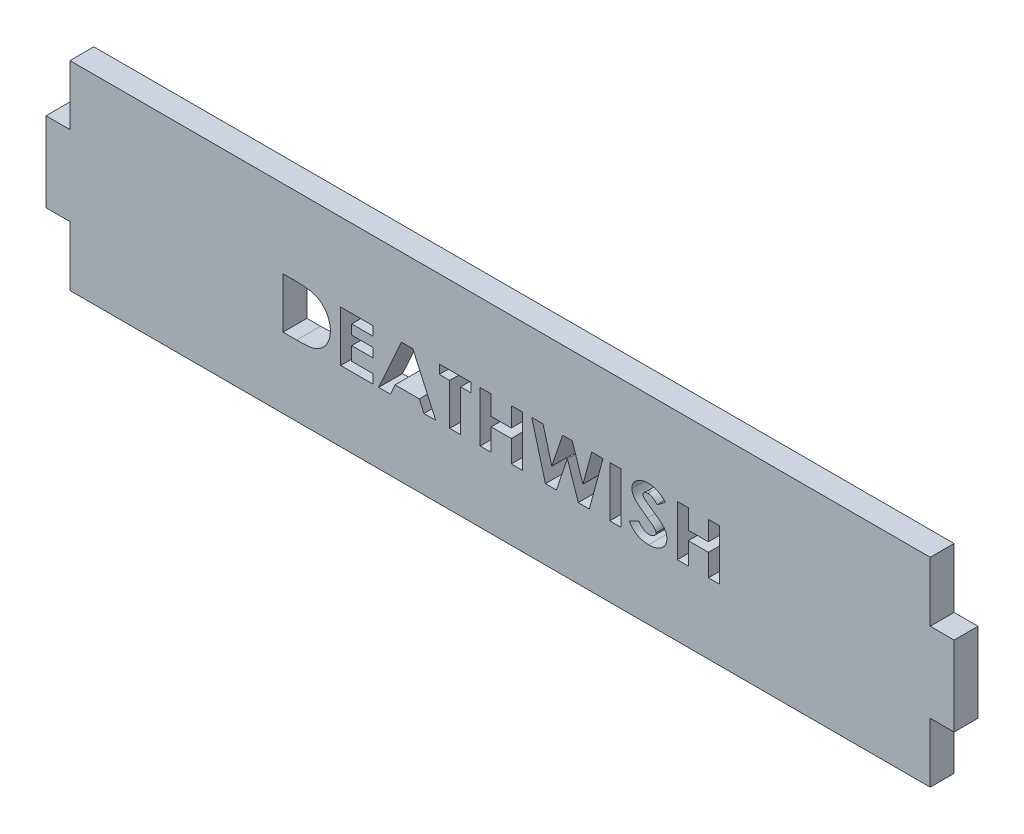
from build123d import *

# Parameters (mm, degrees)
BOSS_EXTRUDE1_DEPTH = 3
WRAP1_START         = -3
WRAP1_OUTLINE_W     = 1.383974359
WRAP1_OUTLINE_H     = 6.35
WRAP1_DEPTH         = 3


# Read off the part's stored shape, not the designer's step: Wrap1
with BuildPart() as part:
    # Sketch1 → Boss-Extrude1 (new body)
    with BuildSketch(Plane.XY):
        Polygon((54, -5), (54, -12.5), (-54, -12.5), (-54, -5), (-57, -5), (-57, 5), (-54, 5), (-54, 12.5), (54, 12.5), (54, 5), (57, 5), (57, -5), align=None)
    extrude(amount=BOSS_EXTRUDE1_DEPTH)

    # Wrap1 outline → Wrap1 (cut)
    with BuildSketch(Plane.XY.offset(3).offset(WRAP1_START)):
        with BuildLine():
            add(Edge.make_bspline(
                [(19.719246452, 1.072586443), (19.673401835, 1.124225586), (19.584720231, 1.224116093), (19.442937176, 1.356836127), (19.300478912, 1.469406847), (19.157579951, 1.561886065), (19.014110041, 1.634456814), (18.869277928, 1.685740762), (18.723379294, 1.717847792), (18.625451821, 1.721874497), (18.576958791, 1.723868494)],
                knots=[0, 0, 0, 0, 0.152659398, 0.295303603, 0.428877079, 0.553739135, 0.671167669, 0.783579981, 0.892830255, 1, 1, 1, 1], degree=3))
            Line((19.719246452, 1.072586443), (20.783939961, 1.852344055))
            add(Edge.make_bspline(
                [(18.613847814, 2.863612084), (18.70643363, 2.860873856), (18.890380695, 2.855433617), (19.16228875, 2.81326962), (19.427575195, 2.745992557), (19.642797731, 2.665774715), (19.813752234, 2.586623289), (19.944941907, 2.515071376), (20.07825411, 2.43143095), (20.216252432, 2.33952036), (20.354153761, 2.232877684), (20.495878314, 2.116718826), (20.640899351, 1.990251419), (20.735567321, 1.898980764), (20.783939961, 1.852344055)],
                knots=[0, 0, 0, 0, 0.112750237, 0.224009204, 0.33438332, 0.445685447, 0.503228736, 0.563788081, 0.627576777, 0.694912236, 0.765680889, 0.839822751, 0.918153981, 1, 1, 1, 1], degree=3))
            add(Edge.make_bspline(
                [(16.550606628, 1.25321545), (16.552167553, 1.307613976), (16.555249959, 1.41503643), (16.584415688, 1.573159065), (16.631608342, 1.725098667), (16.697108485, 1.871051885), (16.780618975, 2.011493206), (16.884491355, 2.144676521), (17.006080325, 2.272300549), (17.14416979, 2.39222325), (17.295915834, 2.502386826), (17.458624243, 2.598965288), (17.630359097, 2.680681123), (17.810182703, 2.748535855), (17.998874304, 2.80042905), (18.196262366, 2.83745452), (18.402207702, 2.859016452), (18.542563622, 2.862064193), (18.613847814, 2.863612084)],
                knots=[0, 0, 0, 0, 0.056170461, 0.110921546, 0.165526908, 0.220249932, 0.275858717, 0.333966338, 0.394404589, 0.457760192, 0.522706535, 0.587934591, 0.653003504, 0.719006979, 0.786299609, 0.854964891, 0.926339335, 1, 1, 1, 1], degree=3))
            add(Edge.make_bspline(
                [(18.523533311, -0.97539032), (18.424075574, -0.907042495), (18.233457958, -0.776049173), (17.963244973, -0.582337552), (17.720104258, -0.401105641), (17.505097159, -0.230916602), (17.317716127, -0.072977709), (17.156492133, 0.071260309), (17.023759429, 0.204442524), (16.91596119, 0.32801057), (16.829642335, 0.446549171), (16.754552473, 0.561418865), (16.692554997, 0.676993622), (16.64111885, 0.792622531), (16.599757539, 0.9075868), (16.572438211, 1.023321193), (16.552878188, 1.138066694), (16.551361041, 1.214973115), (16.550606628, 1.25321545)],
                knots=[0, 0, 0, 0, 0.11724404, 0.224706294, 0.32299845, 0.411847771, 0.491072557, 0.561070729, 0.621952114, 0.673650235, 0.720202811, 0.764310708, 0.806887658, 0.847460379, 0.88719842, 0.925365868, 0.962887579, 1, 1, 1, 1], degree=3))
            add(Edge.make_bspline(
                [(19.562786115, -2.070612675), (19.560703997, -2.034249343), (19.556434143, -1.95967813), (19.515799337, -1.850105941), (19.455190375, -1.74062135), (19.384696712, -1.651377285), (19.312833797, -1.576388272), (19.242436675, -1.512273418), (19.158696848, -1.439340768), (19.058882889, -1.361211416), (18.94566796, -1.2747121), (18.818581091, -1.180208885), (18.675771695, -1.080329999), (18.575728703, -1.011369208), (18.523533311, -0.97539032)],
                knots=[0, 0, 0, 0, 0.069656103, 0.142845548, 0.221998529, 0.309697071, 0.360419396, 0.421544443, 0.492611602, 0.573810517, 0.665086112, 0.766465276, 0.878158015, 1, 1, 1, 1], degree=3))
            add(Edge.make_bspline(
                [(18.688897894, -2.672285352), (18.748456429, -2.670303674), (18.863552102, -2.666474122), (19.028103054, -2.630935131), (19.17898, -2.575443349), (19.310126356, -2.495335577), (19.421246783, -2.403650429), (19.502572821, -2.300351922), (19.554387547, -2.188300791), (19.559995875, -2.109711979), (19.562786115, -2.070612675)],
                knots=[0, 0, 0, 0, 0.152897008, 0.2954704, 0.430684796, 0.564139584, 0.688618973, 0.798927781, 0.899963069, 1, 1, 1, 1], degree=3))
            add(Edge.make_bspline(
                [(17.433399096, -1.858182788), (17.47838077, -1.922733208), (17.565307704, -2.047476682), (17.711239748, -2.212734273), (17.860184903, -2.354521837), (18.015110736, -2.470775904), (18.176132952, -2.560469536), (18.342418332, -2.625307473), (18.514041923, -2.664929211), (18.630605876, -2.669833023), (18.688897894, -2.672285352)],
                knots=[0, 0, 0, 0, 0.151131279, 0.292060695, 0.42295247, 0.545866055, 0.663349338, 0.776115142, 0.888038283, 1, 1, 1, 1], degree=3))
            Line((17.433399096, -1.858182788), (16.224965602, -2.459855464))
            add(Edge.make_bspline(
                [(18.641832589, -3.812028941), (18.576080432, -3.811082137), (18.446515105, -3.80921645), (18.255400672, -3.793547964), (18.070619205, -3.768339328), (17.89215972, -3.732767085), (17.720077491, -3.686929042), (17.554575131, -3.631295848), (17.39591194, -3.564331197), (17.242748975, -3.488476763), (17.095971952, -3.399879146), (16.954497682, -3.300851248), (16.819386413, -3.189300666), (16.688896378, -3.066928387), (16.565007305, -2.931715235), (16.444605121, -2.78616447), (16.329981925, -2.628736348), (16.260316161, -2.516704089), (16.224965602, -2.459855464)],
                knots=[0, 0, 0, 0, 0.067695667, 0.133395033, 0.197301531, 0.25963615, 0.320636965, 0.38055795, 0.43926413, 0.497840285, 0.556393655, 0.615625126, 0.675496782, 0.736652083, 0.799680074, 0.864190716, 0.931086178, 1, 1, 1, 1], degree=3))
            add(Edge.make_bspline(
                [(20.946760474, -2.004466842), (20.944733228, -2.068591634), (20.940750951, -2.194556936), (20.911399852, -2.379752377), (20.859725167, -2.555073839), (20.791153115, -2.723299641), (20.699221814, -2.881109309), (20.590102734, -3.032338138), (20.458202256, -3.172762895), (20.309203947, -3.3040484), (20.143957638, -3.423372547), (19.965311571, -3.528266525), (19.774112173, -3.615615695), (19.571054562, -3.687492968), (19.355993126, -3.742820404), (19.128599282, -3.783651431), (18.889147195, -3.80811968), (18.725420645, -3.810707679), (18.641832589, -3.812028941)],
                knots=[0, 0, 0, 0, 0.058731266, 0.115370381, 0.171176354, 0.225851727, 0.281350033, 0.338062346, 0.396328134, 0.45742003, 0.519729533, 0.58274682, 0.646875847, 0.711984232, 0.779812749, 0.850056995, 0.92344892, 1, 1, 1, 1], degree=3))
            add(Edge.make_bspline(
                [(20.136474016, -0.547986473), (20.205708122, -0.608429897), (20.337770007, -0.723723832), (20.511141592, -0.904421013), (20.653575235, -1.08057452), (20.764356743, -1.255894142), (20.845454385, -1.434005777), (20.905626155, -1.616623541), (20.940155674, -1.80811211), (20.944545318, -1.938612256), (20.946760474, -2.004466842)],
                knots=[0, 0, 0, 0, 0.159565823, 0.304366804, 0.434332212, 0.552441623, 0.663491149, 0.773416579, 0.885658692, 1, 1, 1, 1], degree=3))
            add(Edge.make_bspline(
                [(19.129022093, 0.184705834), (19.194725417, 0.138462966), (19.319400015, 0.050715336), (19.496798795, -0.073547847), (19.652740503, -0.186378944), (19.790428387, -0.282577166), (19.904817582, -0.369251959), (20.000668848, -0.439750861), (20.07558547, -0.498059862), (20.118294822, -0.533080131), (20.136474016, -0.547986473)],
                knots=[0, 0, 0, 0, 0.193455233, 0.367088787, 0.521492782, 0.656907828, 0.771457166, 0.867016653, 0.943395768, 1, 1, 1, 1], degree=3))
            add(Edge.make_bspline(
                [(18.064328583, 1.003896539), (18.082296869, 0.985382441), (18.124142156, 0.942266044), (18.203620225, 0.875894496), (18.303010738, 0.793245067), (18.425974928, 0.698424166), (18.569344441, 0.588384204), (18.736940682, 0.467270387), (18.924385657, 0.329026221), (19.058447763, 0.234478567), (19.129022093, 0.184705834)],
                knots=[0, 0, 0, 0, 0.057529563, 0.133977227, 0.230759984, 0.346009525, 0.480349956, 0.633995626, 0.807324277, 1, 1, 1, 1], degree=3))
            add(Edge.make_bspline(
                [(17.934580987, 1.307912966), (17.935838138, 1.281384516), (17.938390895, 1.227516141), (17.966595989, 1.149790835), (18.005458852, 1.072264362), (18.044152094, 1.02732832), (18.064328583, 1.003896539)],
                knots=[0, 0, 0, 0, 0.234387218, 0.475944074, 0.726732412, 1, 1, 1, 1], degree=3))
            add(Edge.make_bspline(
                [(18.576958791, 1.723868494), (18.53189786, 1.722629762), (18.44530191, 1.720249225), (18.321618763, 1.695831466), (18.210774194, 1.655019677), (18.114552232, 1.599603598), (18.036581777, 1.534581229), (17.9769964, 1.464739534), (17.941915829, 1.387623705), (17.936989292, 1.334085011), (17.934580987, 1.307912966)],
                knots=[0, 0, 0, 0, 0.160784811, 0.308988589, 0.447952035, 0.580944808, 0.70349073, 0.808979184, 0.906620706, 1, 1, 1, 1], degree=3))
        make_face()
        with BuildLine():
            add(Edge.make_bspline(
                [(-25.557576465, 2.700791571), (-25.425688765, 2.700009022), (-25.170705642, 2.698496093), (-24.801211637, 2.681445092), (-24.457947149, 2.655318067), (-24.14076059, 2.619235774), (-23.849809951, 2.571343699), (-23.585158435, 2.511966647), (-23.346458836, 2.442727543), (-23.131092949, 2.361684654), (-22.934152086, 2.266860538), (-22.747417482, 2.161453632), (-22.570571241, 2.041246555), (-22.401811315, 1.90868736), (-22.242358754, 1.761918874), (-22.092504532, 1.600751491), (-21.949606359, 1.428163543), (-21.817704114, 1.242222764), (-21.696923692, 1.046595117), (-21.592364511, 0.840481289), (-21.503129409, 0.62673636), (-21.430210251, 0.404332514), (-21.374801029, 0.173613689), (-21.333918158, -0.064704796), (-21.309111209, -0.311282383), (-21.306492445, -0.478390979), (-21.305162603, -0.563250897)],
                knots=[0, 0, 0, 0, 0.064682562, 0.125053069, 0.181373286, 0.233506669, 0.281576806, 0.32592416, 0.366460862, 0.403385688, 0.438640563, 0.473566974, 0.508463652, 0.543411727, 0.578735234, 0.614635613, 0.651275301, 0.688553917, 0.726361302, 0.763936324, 0.801786011, 0.839864113, 0.878602084, 0.918056892, 0.958388225, 1, 1, 1, 1], degree=3))
            Line((-25.557576465, 2.700791571), (-27.248111321, 2.700791571))
            Line((-27.248111321, 2.700791571), (-27.248111321, -3.649208429))
            Line((-27.248111321, -3.649208429), (-25.53213576, -3.649208429))
            add(Edge.make_bspline(
                [(-21.305162603, -0.563250897), (-21.306357933, -0.623899623), (-21.308717706, -0.743629861), (-21.320950733, -0.921678597), (-21.344722673, -1.095530942), (-21.374275868, -1.266567312), (-21.415518796, -1.433314338), (-21.465345863, -1.59673515), (-21.52337837, -1.756651306), (-21.613377932, -1.962781057), (-21.743609941, -2.207312094), (-21.928832359, -2.478108484), (-22.143066622, -2.721729666), (-22.383016413, -2.93645215), (-22.641084001, -3.123100577), (-22.911398963, -3.280631526), (-23.192833012, -3.406188196), (-23.439901791, -3.485200804), (-23.654753418, -3.534669887), (-23.843688708, -3.563511861), (-24.058673123, -3.590621756), (-24.301029651, -3.611155915), (-24.570257217, -3.629685159), (-24.866806913, -3.639708107), (-25.190334807, -3.648065238), (-25.415101577, -3.648816995), (-25.53213576, -3.649208429)],
                knots=[0, 0, 0, 0, 0.030361655, 0.05993874, 0.089264998, 0.118157205, 0.14677764, 0.175176881, 0.203645034, 0.231875647, 0.287706288, 0.342042914, 0.395730297, 0.449682155, 0.502876029, 0.554894698, 0.606009719, 0.656819361, 0.684467156, 0.716288442, 0.75243222, 0.792918197, 0.838010285, 0.88749821, 0.941421256, 1, 1, 1, 1], degree=3))
        make_face()
        Polygon((26.157016884, 0.258483879), (23.633298936, 0.258483879), (23.633298936, 2.700791571), (22.249324577, 2.700791571), (22.249324577, -3.649208429), (23.633298936, -3.649208429), (23.633298936, -0.881259711), (26.157016884, -0.881259711), (26.157016884, -3.649208429), (27.540991243, -3.649208429), (27.540991243, 2.700791571), (26.157016884, 2.700791571), align=None)
        Polygon((1.408298936, 2.700791571), (1.408298936, 0.258483879), (-1.115419013, 0.258483879), (-1.115419013, 2.700791571), (-2.499393372, 2.700791571), (-2.499393372, -3.649208429), (-1.115419013, -3.649208429), (-1.115419013, -0.881259711), (1.408298936, -0.881259711), (1.408298936, -3.649208429), (2.792273295, -3.649208429), (2.792273295, 2.700791571), align=None)
        with Locations((14.47464509, -0.474208429)):
            Rectangle(WRAP1_OUTLINE_W, WRAP1_OUTLINE_H)
        Polygon((10.404132269, -1.353184791), (9.055774897, 2.700791571), (7.851157509, 2.700791571), (6.496439961, -1.353184791), (5.396129464, 2.700791571), (3.972722013, 2.700791571), (5.69760182, -3.649208429), (7.079032109, -3.649208429), (8.450286115, 0.455649344), (9.81645198, -3.649208429), (11.20551448, -3.649208429), (12.927850218, 2.700791571), (11.50317073, 2.700791571), align=None)
        Polygon((-3.639136962, 1.561047982), (-3.639136962, 2.700791571), (-7.628239526, 2.700791571), (-7.628239526, 1.561047982), (-6.325675423, 1.561047982), (-6.325675423, -3.649208429), (-4.941701064, -3.649208429), (-4.941701064, 1.561047982), align=None)
        Polygon((-8.075995936, -3.649208429), (-10.948251545, 2.700791571), (-12.367842891, 2.700791571), (-15.2400985, -3.649208429), (-13.759449462, -3.649208429), (-13.183217491, -2.346644326), (-10.134148981, -2.346644326), (-9.556644975, -3.649208429), align=None)
        Polygon((-15.93208568, 1.561047982), (-15.93208568, 2.700791571), (-20.0025985, 2.700791571), (-20.0025985, -3.649208429), (-15.93208568, -3.649208429), (-15.93208568, -2.509464839), (-18.618624141, -2.509464839), (-18.618624141, -0.799849454), (-15.93208568, -0.799849454), (-15.93208568, 0.339894135), (-18.618624141, 0.339894135), (-18.618624141, 1.561047982), align=None)
    extrude(amount=WRAP1_DEPTH, mode=Mode.SUBTRACT)


solid = part.part
